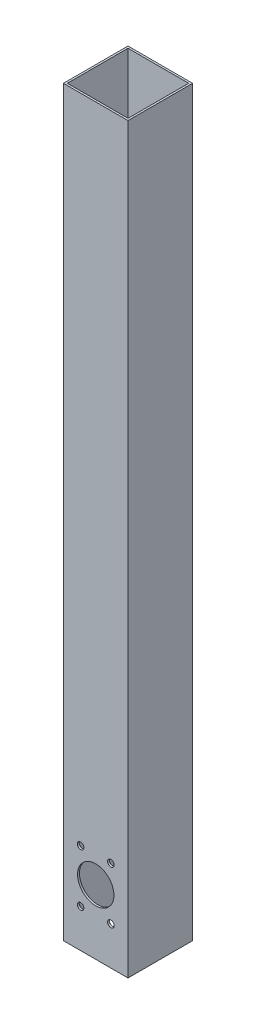
from build123d import *

# Parameters (mm, degrees)
SKETCH1_W               = 50.8
SKETCH1_H               = 50.8
SKETCH1_W_2             = 47.752
SKETCH1_H_2             = 47.752
EXTRUDE_THIN1_DEPTH     = 584.2
CUT_EXTRUDE1_DEPTH      = 586.303305988
CUT_EXTRUDE1_DEPTH_BACK = 586.303305988
SKETCH2_R               = 14.3002
SKETCH2_R_2             = 2.5908


with BuildPart() as part:
    # Sketch1 → Extrude-Thin1 (new body)
    with BuildSketch(Plane(origin=(0, 0, 0), x_dir=(1, 0, 0), z_dir=(0, 1, 0))):
        Rectangle(SKETCH1_W, SKETCH1_H)
        Rectangle(SKETCH1_W_2, SKETCH1_H_2, mode=Mode.SUBTRACT)
    extrude(amount=EXTRUDE_THIN1_DEPTH)

    # Sketch2 → Cut-Extrude1 (cut, two sides: drawn at the far end of the back side and taken through both)
    with BuildSketch(Plane.XY.offset(-CUT_EXTRUDE1_DEPTH_BACK)):
        with Locations((0, 50.8)):
            Circle(SKETCH2_R)
        with Locations((-11.9126, 30.16677155)):
            Circle(SKETCH2_R_2)
        with Locations((11.9126, 30.16677155)):
            Circle(SKETCH2_R_2)
        with Locations((11.9126, 71.43322845)):
            Circle(SKETCH2_R_2)
        with Locations((-11.9126, 71.43322845)):
            Circle(SKETCH2_R_2)
    extrude(amount=CUT_EXTRUDE1_DEPTH + CUT_EXTRUDE1_DEPTH_BACK, mode=Mode.SUBTRACT)


solid = part.part
